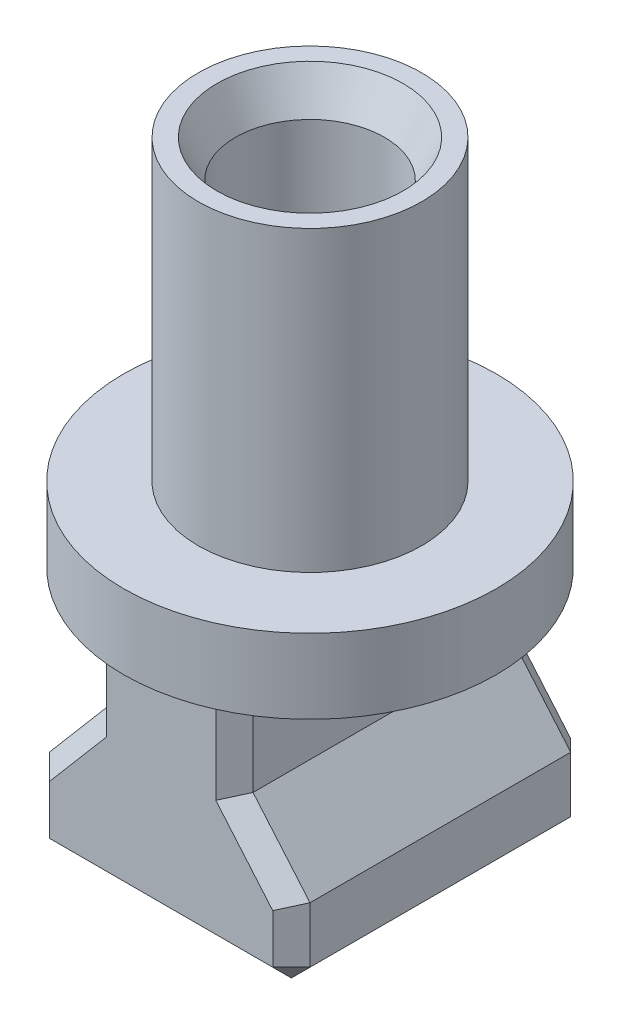
from build123d import *

# Parameters (mm, degrees)
BOSS_EXTRUDE9_DEPTH      = 5.6
BOSS_EXTRUDE9_DEPTH_BACK = 2
SKETCH16_W               = 8
SKETCH16_H               = 3.5
BOSS_EXTRUDE11_DEPTH     = 8
CHAMFER2_SIZE            = 1.5
SKETCH17_W               = 3.94
SKETCH17_H               = 8
BOSS_EXTRUDE12_DEPTH     = 6.3
CUT_EXTRUDE2_START       = -5.6
CUT_EXTRUDE2_DEPTH       = 3.6
SKETCH21_R               = 1.5
BOSS_EXTRUDE14_DEPTH     = 3.6
CHAMFER4_SIZE            = 1
CUT_EXTRUDE3_DEPTH       = 3.6
SPLIT1_START             = -2
SPLIT1_DEPTH             = 7.6
SKETCH22_R               = 5
BOSS_EXTRUDE15_DEPTH     = 2
SKETCH23_R               = 3
BOSS_EXTRUDE16_DEPTH     = 8
CUT_EXTRUDE4_DEPTH       = 32.952026383
CUT_EXTRUDE4_DEPTH_BACK  = 8
SKETCH24_R               = 2
CHAMFER5_SIZE            = 0.5
CHAMFER5_SIZE2           = 1
SKETCH25_W               = 1.53
SKETCH25_H               = 2
BOSS_EXTRUDE17_DEPTH     = 8
CHAMFER6_SIZE            = 0.5


# Read off the part's stored shape, not the designer's step: Split1
with BuildPart() as part:
    # Sketch14 → Boss-Extrude9 (new, two sides: drawn at the far end of the back side and taken through both)
    with BuildSketch(Plane(origin=(0, 0, 0), x_dir=(1, 0, 0), z_dir=(0, 1, 0)).offset(-BOSS_EXTRUDE9_DEPTH_BACK)):
        with BuildLine():
            Line((-4.172171186, -20.619968889), (-4.172171186, -25.619968889))
            Line((-4.172171186, -25.619968889), (7.827828814, -25.619968889))
            Line((7.827828814, -25.619968889), (7.827828814, -20.619968889))
            ThreePointArc((7.827828814, -20.619968889), (1.827828814, -14.619968889), (-4.172171186, -20.619968889))
        make_face()
    extrude(amount=BOSS_EXTRUDE9_DEPTH + BOSS_EXTRUDE9_DEPTH_BACK)

    # Sketch16 → Boss-Extrude11 (add)
    with BuildSketch(Plane.XY.offset(25.619968889)):
        with Locations((1.827828814, 1.75)):
            Rectangle(SKETCH16_W, SKETCH16_H)
    extrude(amount=BOSS_EXTRUDE11_DEPTH)

    # Chamfer2
    chamfer2_edges = [part.edges().sort_by_distance(p)[0] for p in [
        (1.827828814, -2, 14.619968889),
        (7.827828814, 5.6, 23.119968889),
        (1.827828814, 5.6, 14.619968889),
        (-4.172171186, -2, 23.119968889),
        (-4.172171186, 5.6, 23.119968889),
        (7.827828814, -2, 23.119968889),
    ]]
    chamfer(chamfer2_edges, length=CHAMFER2_SIZE)

    # Sketch17 → Boss-Extrude12 (add)
    with BuildSketch(Plane.XZ.offset(2)):
        with Locations((1.827828814, 21.619968889)):
            Rectangle(SKETCH17_W, SKETCH17_H)
    extrude(amount=BOSS_EXTRUDE12_DEPTH)

    # Sketch20 → Cut-Extrude2 (cut)
    with BuildSketch(Plane(origin=(0, 5.6, 0), x_dir=(1, 0, 0), z_dir=(0, 1, 0)).offset(CUT_EXTRUDE2_START)):
        with BuildLine():
            Line((7.827828814, -20.619968889), (-4.172171186, -20.619968889))
            ThreePointArc((-4.172171186, -20.619968889), (1.827828814, -14.619968889), (7.827828814, -20.619968889))
        make_face()
    extrude(amount=CUT_EXTRUDE2_DEPTH, mode=Mode.SUBTRACT)

    # Sketch21 → Boss-Extrude14 (add)
    with BuildSketch(Plane(origin=(0, 0, 0), x_dir=(1, 0, 0), z_dir=(0, 1, 0))):
        with BuildLine():
            ThreePointArc((7.827828814, -20.619968889), (7.63955943, -19.128732072), (7.086566399, -17.731080001))
            ThreePointArc((7.086566399, -17.731080001), (6.279209969, -19.350325806), (4.990106474, -20.619968889))
            Line((4.990106474, -20.619968889), (7.827828814, -20.619968889))
        make_face()
        with BuildLine():
            ThreePointArc((-1.334448847, -20.619968889), (-2.623552342, -19.350325806), (-3.430908771, -17.731080001))
            ThreePointArc((-3.430908771, -17.731080001), (-3.983901803, -19.128732072), (-4.172171186, -20.619968889))
            Line((-4.172171186, -20.619968889), (-1.334448847, -20.619968889))
        make_face()
        with Locations(Location((1.827828814, -16.119968889, 0), (0, 0, 90.000763944))):
            Circle(SKETCH21_R)
    extrude(amount=BOSS_EXTRUDE14_DEPTH)

    # Chamfer4
    # the kernel refuses this chamfer: 1 mm, written as the material it adds along each edge
    with BuildSketch(Plane(origin=(1.827828814, 3.6, 16.119968889), x_dir=(-1.3333338100422289e-05, 0, -0.999999999911111), z_dir=(0.999999999911111, 0, -1.3333338100422289e-05))) as chamfer4_piece_1_section:
        Polygon((1.5, -CHAMFER4_SIZE), (1.5 + CHAMFER4_SIZE, 0), (1.5, 0), align=None)
    chamfer4_piece_1 = revolve(axis=Axis((1.827828814, 3.6, 16.119968889), (0, 1, 0)), mode=Mode.PRIVATE)
    chamfer4_piece_1 = chamfer4_piece_1 & Plane(origin=(1.827828814, 3.111670507, 20.619968889), x_dir=(1, 0, 0), z_dir=(0, -1, 0)) * Cylinder(6, 10, mode=Mode.PRIVATE)
    add(chamfer4_piece_1)
    with BuildSketch(Plane(origin=(1.827828814, 0, 16.119968889), x_dir=(-1.3333338100422289e-05, 0, -0.999999999911111), z_dir=(0.999999999911111, 0, -1.3333338100422289e-05))) as chamfer4_piece_2_section:
        Polygon((1.5 + CHAMFER4_SIZE, 0), (1.5, CHAMFER4_SIZE), (1.5, 0), align=None)
    chamfer4_piece_2 = revolve(axis=Axis((1.827828814, 0, 16.119968889), (0, 1, 0)), mode=Mode.PRIVATE)
    chamfer4_piece_2 = chamfer4_piece_2 & Plane(origin=(1.827828814, 0.488329493, 20.619968889), x_dir=(1, 0, 0), z_dir=(0, -1, 0)) * Cylinder(6, 10, mode=Mode.PRIVATE)
    add(chamfer4_piece_2)

    # Sketch21<3> → Cut-Extrude3 (cut)
    with BuildSketch(Plane(origin=(0, 0, 0), x_dir=(1, 0, 0), z_dir=(0, 1, 0))):
        with BuildLine():
            Line((4.990106474, -20.619968889), (-1.334448847, -20.619968889))
            ThreePointArc((-1.334448847, -20.619968889), (1.827828814, -21.619968889), (4.990106474, -20.619968889))
        make_face()
    extrude(amount=CUT_EXTRUDE3_DEPTH, mode=Mode.SUBTRACT)

    # Split1 outline → Split1 (cut)
    with BuildSketch(Plane(origin=(0, 0, 0), x_dir=(1, 0, 0), z_dir=(0, 1, 0)).offset(SPLIT1_START)):
        with BuildLine():
            Line((7.827828814, -25.619968889), (7.827828814, -20.619968889))
            ThreePointArc((7.827828814, -20.619968889), (1.827828814, -14.619968889), (-4.172171186, -20.619968889))
            Line((-4.172171186, -20.619968889), (-4.172171186, -25.619968889))
            Line((-4.172171186, -25.619968889), (-2.172171186, -25.619968889))
            Line((-2.172171186, -25.619968889), (-2.172171186, -33.619968889))
            Line((-2.172171186, -33.619968889), (5.827828814, -33.619968889))
            Line((5.827828814, -33.619968889), (5.827828814, -25.619968889))
            Line((5.827828814, -25.619968889), (7.827828814, -25.619968889))
        make_face()
    extrude(amount=SPLIT1_DEPTH, mode=Mode.SUBTRACT)

    # Sketch22 → Boss-Extrude15 (add)
    with BuildSketch(Plane(origin=(0, -2, 0), x_dir=(1, 0, 0), z_dir=(0, 1, 0))):
        with Locations(Location((1.827828814, -21.619968889, 0), (0, 0, 270))):
            Circle(SKETCH22_R)
    extrude(amount=BOSS_EXTRUDE15_DEPTH)

    # Sketch23 → Boss-Extrude16 (add)
    with BuildSketch(Plane(origin=(0, 0, 0), x_dir=(1, 0, 0), z_dir=(0, 1, 0))):
        with Locations(Location((1.827828814, -21.619968889, 0), (0, 0, 270))):
            Circle(SKETCH23_R)
    extrude(amount=BOSS_EXTRUDE16_DEPTH)

    # Sketch24 → Cut-Extrude4 (cut, two sides: drawn at the far end of the back side and taken through both)
    with BuildSketch(Plane(origin=(0, 8, 0), x_dir=(1, 0, 0), z_dir=(0, 1, 0)).offset(-CUT_EXTRUDE4_DEPTH_BACK)):
        with Locations(Location((1.827828814, -21.619968889, 0), (0, 0, 270))):
            Circle(SKETCH24_R)
    extrude(amount=CUT_EXTRUDE4_DEPTH + CUT_EXTRUDE4_DEPTH_BACK, mode=Mode.SUBTRACT)

    # Chamfer5
    chamfer5_edges = [part.edges().sort_by_distance(p)[0] for p in [
        (1.827828814, 8, 19.619968889),
    ]]
    chamfer5_side = [part.faces().sort_by_distance(p)[0] for p in [
        (1.827828814, 8, 18.704821703),
    ]]
    chamfer(chamfer5_edges, length=CHAMFER5_SIZE, length2=CHAMFER5_SIZE2, reference=chamfer5_side[0])

    # Sketch25 → Boss-Extrude17 (add)
    with BuildSketch(Plane.XY.offset(25.619968889)):
        Polygon((3.797828814, -4.5), (3.797828814, -6.3), (5.327828814, -6.3), align=None)
        with Locations((4.562828814, -7.3)):
            Rectangle(SKETCH25_W, SKETCH25_H)
        with Locations((-0.907171186, -7.3)):
            Rectangle(SKETCH25_W, SKETCH25_H)
        Polygon((-0.142171186, -4.5), (-1.672171186, -6.3), (-0.142171186, -6.3), align=None)
    extrude(amount=-BOSS_EXTRUDE17_DEPTH)

    # Chamfer6
    chamfer6_edges = [part.edges().sort_by_distance(p)[0] for p in [
        (3.797828814, -3.25, 17.619968889),
        (-0.142171186, -3.25, 17.619968889),
        (3.797828814, -3.25, 25.619968889),
        (-0.142171186, -3.25, 25.619968889),
        (5.327828814, -7.3, 17.619968889),
        (5.327828814, -7.3, 25.619968889),
        (5.327828814, -8.3, 21.619968889),
        (4.562828814, -5.4, 25.619968889),
        (4.562828814, -5.4, 17.619968889),
        (-1.672171186, -8.3, 21.619968889),
        (-0.907171186, -5.4, 17.619968889),
        (-0.907171186, -5.4, 25.619968889),
        (-1.672171186, -7.3, 25.619968889),
        (-1.672171186, -7.3, 17.619968889),
        (1.827828814, -8.3, 25.619968889),
        (1.827828814, -8.3, 17.619968889),
    ]]
    chamfer(chamfer6_edges, length=CHAMFER6_SIZE)


solid = part.part
